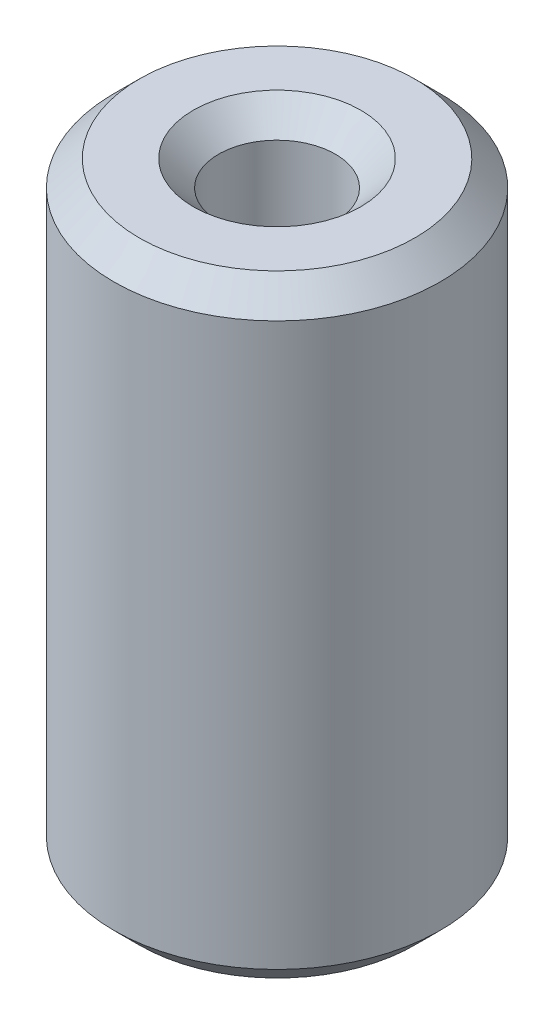
from build123d import *

# Parameters (mm, degrees)
SKETCH1_R           = 15
BOSS_EXTRUDE1_DEPTH = 56.313720626
SKETCH2_R           = 5.36412157
CUT_EXTRUDE1_DEPTH  = 61.176699234
CHAMFER1_SIZE       = 2.334583427


with BuildPart() as part:
    # Sketch1 → Boss-Extrude1 (new body)
    with BuildSketch(Plane(origin=(0, 0, 0), x_dir=(1, 0, 0), z_dir=(0, 1, 0))):
        Circle(SKETCH1_R)
    extrude(amount=BOSS_EXTRUDE1_DEPTH)

    # Sketch2 → Cut-Extrude1 (cut, through all)
    with BuildSketch(Plane(origin=(0, 0, 0), x_dir=(1, 0, 0), z_dir=(0, 1, 0))):
        Circle(SKETCH2_R)
    extrude(amount=CUT_EXTRUDE1_DEPTH, mode=Mode.SUBTRACT)

    # Chamfer1
    chamfer1_edges = [part.edges().sort_by_distance(p)[0] for p in [
        (-5.36412157, 56.313720626, 0),
        (-5.36412157, 0, 0),
        (-15, 0, 0),
        (-15, 56.313720626, 0),
    ]]
    chamfer(chamfer1_edges, length=CHAMFER1_SIZE)


solid = part.part
